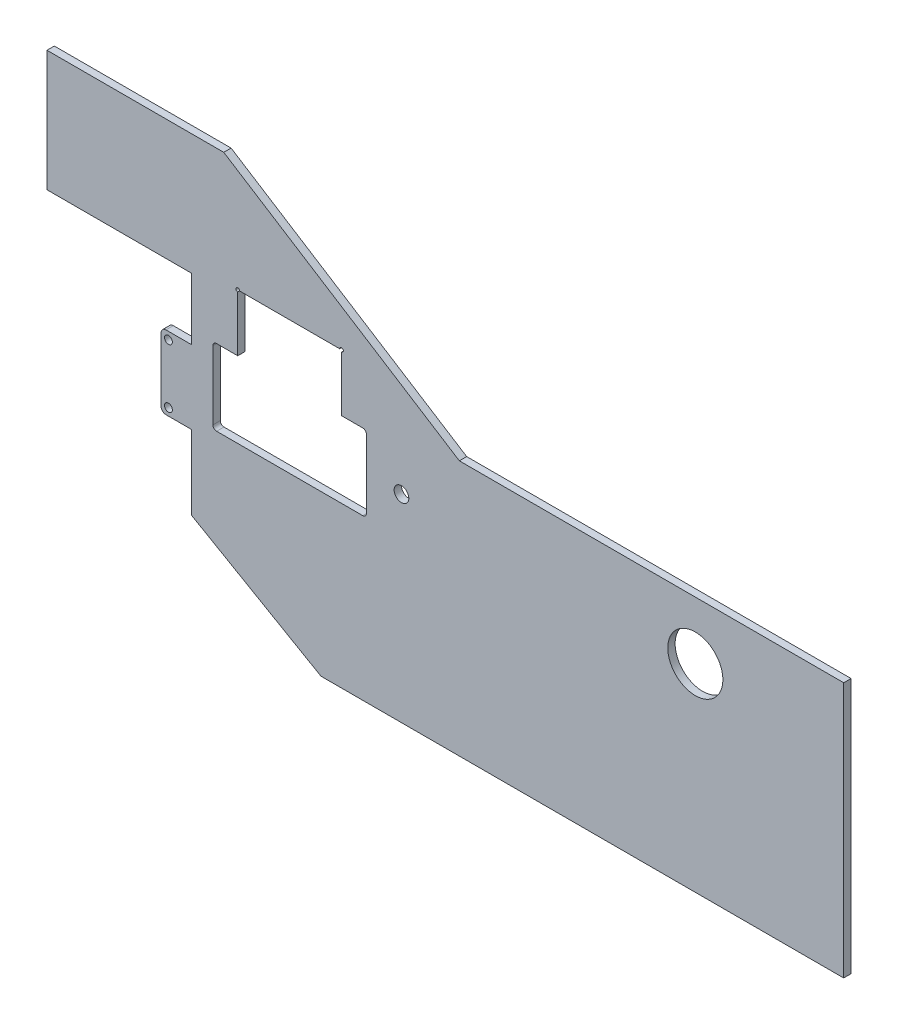
from build123d import *

# Parameters (mm, degrees)
SKETCH1_W           = 184.414327478
SKETCH1_H           = 83.61431582
BOSS_EXTRUDE1_DEPTH = 3
SKETCH2_R           = 3
CUT_EXTRUDE1_DEPTH  = 70
SKETCH3_R           = 11.25
CUT_EXTRUDE2_DEPTH  = 3
SKETCH4_R           = 1.6
BOSS_EXTRUDE2_DEPTH = 3
CUT_EXTRUDE3_DEPTH  = 10


with BuildPart() as part:
    # Sketch1 → Boss-Extrude1 (new body)
    with BuildSketch(Plane.XY):
        with Locations((112.494062572, 5.79284209)):
            Rectangle(SKETCH1_W, SKETCH1_H)
    extrude(amount=BOSS_EXTRUDE1_DEPTH)

    # Sketch2 → Cut-Extrude1 (cut)
    with BuildSketch(Plane(origin=(0, 0, 0), x_dir=(-1, 0, 0), z_dir=(0, 0, -1))):
        with Locations((-24.116880081, 24)):
            Circle(SKETCH2_R)
    extrude(amount=-CUT_EXTRUDE1_DEPTH, mode=Mode.SUBTRACT)

    # Sketch3 → Cut-Extrude2 (cut)
    with BuildSketch(Plane.XY.offset(3)):
        with Locations((144.116880081, 24)):
            Circle(SKETCH3_R)
    extrude(amount=-CUT_EXTRUDE2_DEPTH, mode=Mode.SUBTRACT)

    # Sketch4 → Boss-Extrude2 (add)
    with BuildSketch(Plane.XY.offset(3)):
        with BuildLine():
            Line((-61.543119919, 59.260158943), (-61.543119919, 34))
            Line((-61.543119919, 34), (-72.043119919, 34))
            ThreePointArc((-72.043119919, 34), (-73.457333481, 33.414213562), (-74.043119919, 32))
            Line((-74.043119919, 32), (-74.043119919, 6))
            ThreePointArc((-74.043119919, 6), (-73.457333481, 4.585786438), (-72.043119919, 4))
            Line((-72.043119919, 4), (-61.543119919, 4))
            Line((-61.543119919, 4), (-61.543119919, -26.386498553))
            Line((-61.543119919, -26.386498553), (-8.757250831, -56.821879063))
            Line((-8.757250831, -56.821879063), (204.701226311, -56.821879063))
            Line((204.701226311, -56.821879063), (204.701226311, -36.01431582))
            Line((204.701226311, -36.01431582), (20.286898833, -36.01431582))
            Line((20.286898833, -36.01431582), (20.286898833, 47.6))
            Line((20.286898833, 47.6), (47.758430482, 47.6))
            Line((47.758430482, 47.6), (-48.452601838, 108.603325903))
            Line((-48.452601838, 108.603325903), (-120.647186992, 108.603325903))
            Line((-120.647186992, 108.603325903), (-120.647186992, 59.260158943))
            Line((-120.647186992, 59.260158943), (-61.543119919, 59.260158943))
        make_face()
        with Locations((-71.043119919, 31)):
            Circle(SKETCH4_R, mode=Mode.SUBTRACT)
        with Locations((-71.043119919, 7)):
            Circle(SKETCH4_R, mode=Mode.SUBTRACT)
    extrude(amount=-BOSS_EXTRUDE2_DEPTH)

    # Sketch5 → Cut-Extrude3 (cut)
    with BuildSketch(Plane.XY.offset(3)):
        with BuildLine():
            Line((-51.373138671, 8.5), (8.286898833, 8.5))
            ThreePointArc((8.286898833, 8.5), (9.347559005, 8.939339828), (9.786898833, 10))
            Line((9.786898833, 10), (9.786898833, 38))
            ThreePointArc((9.786898833, 38), (9.347559005, 39.060660172), (8.286898833, 39.5))
            Line((8.286898833, 39.5), (-0.343119919, 39.5))
            Line((-0.343119919, 39.5), (-0.343119919, 62.05))
            ThreePointArc((-0.343119919, 62.05), (0.187210167, 63.330330086), (-1.093119919, 62.8))
            Line((-1.093119919, 62.8), (-41.993119919, 62.8))
            ThreePointArc((-41.993119919, 62.8), (-43.273450005, 63.330330086), (-42.743119919, 62.05))
            Line((-42.743119919, 62.05), (-42.743119919, 39.5))
            Line((-42.743119919, 39.5), (-51.373138671, 39.5))
            ThreePointArc((-51.373138671, 39.5), (-52.433798843, 39.060660172), (-52.873138671, 38))
            Line((-52.873138671, 38), (-52.873138671, 10))
            ThreePointArc((-52.873138671, 10), (-52.433798843, 8.939339828), (-51.373138671, 8.5))
        make_face()
    extrude(amount=-CUT_EXTRUDE3_DEPTH, mode=Mode.SUBTRACT)


solid = part.part
